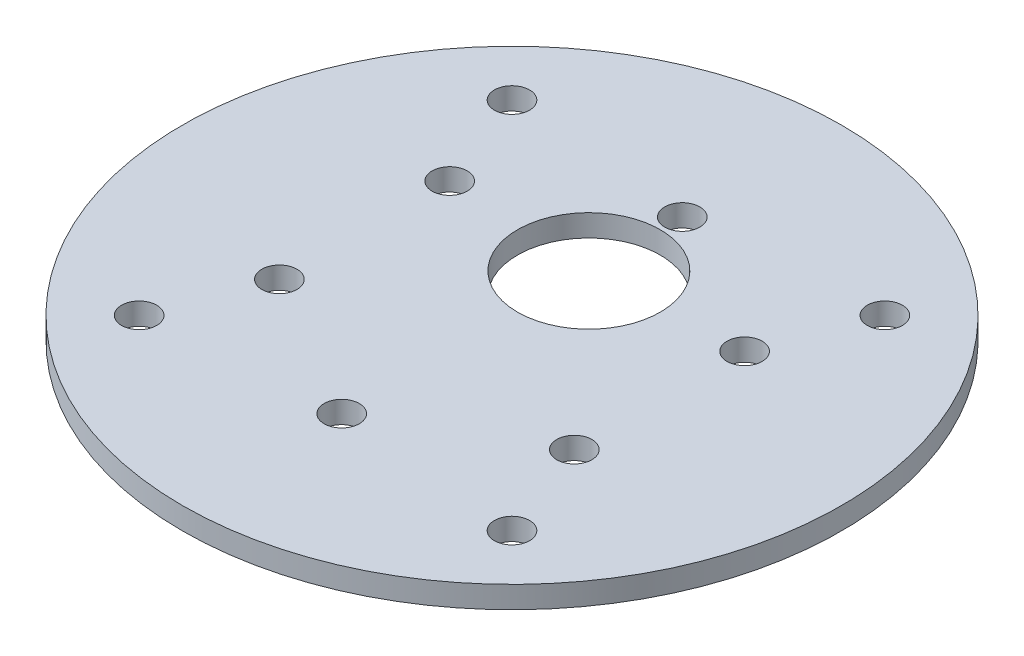
from build123d import *

# Parameters (mm, degrees)
SKETCH_1_R      = 30
SKETCH_1_R_2    = 6.5
SKETCH_1_R_3    = 1.6
EXTRUDE_1_DEPTH = 2


with BuildPart() as part:
    # 草图1 → 凸台-拉伸1 (new body)
    with BuildSketch(Plane(origin=(0, 0, 0), x_dir=(1, 0, 0), z_dir=(0, 1, 0))):
        Circle(SKETCH_1_R)
        with Locations((0, 7)):
            Circle(SKETCH_1_R_2, mode=Mode.SUBTRACT)
        with Locations((0, 15.5)):
            Circle(SKETCH_1_R_3, mode=Mode.SUBTRACT)
        with Locations((13.423393759, 7.75)):
            Circle(SKETCH_1_R_3, mode=Mode.SUBTRACT)
        with Locations((13.423393759, -7.75)):
            Circle(SKETCH_1_R_3, mode=Mode.SUBTRACT)
        with Locations((0, -15.5)):
            Circle(SKETCH_1_R_3, mode=Mode.SUBTRACT)
        with Locations((-13.423393759, -7.75)):
            Circle(SKETCH_1_R_3, mode=Mode.SUBTRACT)
        with Locations((-13.423393759, 7.75)):
            Circle(SKETCH_1_R_3, mode=Mode.SUBTRACT)
        with Locations((16.970562748, -16.970562748)):
            Circle(SKETCH_1_R_3, mode=Mode.SUBTRACT)
        with Locations((-16.970562748, -16.970562748)):
            Circle(SKETCH_1_R_3, mode=Mode.SUBTRACT)
        with Locations((-16.970562748, 16.970562748)):
            Circle(SKETCH_1_R_3, mode=Mode.SUBTRACT)
        with Locations((16.970562748, 16.970562748)):
            Circle(SKETCH_1_R_3, mode=Mode.SUBTRACT)
    extrude(amount=EXTRUDE_1_DEPTH)


solid = part.part
